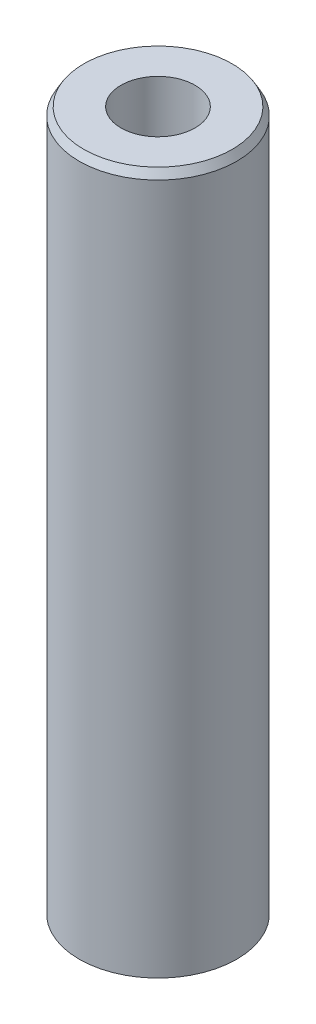
from build123d import *
from OCP.BRepFilletAPI import BRepFilletAPI_MakeChamfer

# Parameters (mm, degrees)
SKETCH1_R           = 27.5
BOSS_EXTRUDE1_DEPTH = 245.557551608
SKETCH2_R           = 12.927279261
CUT_EXTRUDE1_DEPTH  = 249.618203581
CHAMFER1_SIZE       = 2.784341038
CHAMFER1_SIZE2      = 1.607540048


with BuildPart() as part:
    # Sketch1 → Boss-Extrude1 (new body)
    with BuildSketch(Plane(origin=(0, 0, 0), x_dir=(1, 0, 0), z_dir=(0, 1, 0))):
        Circle(SKETCH1_R)
    extrude(amount=BOSS_EXTRUDE1_DEPTH)

    # Sketch2 → Cut-Extrude1 (cut, through all)
    with BuildSketch(Plane(origin=(0, 0, 0), x_dir=(1, 0, 0), z_dir=(0, 1, 0))):
        Circle(SKETCH2_R)
    extrude(amount=CUT_EXTRUDE1_DEPTH, mode=Mode.SUBTRACT)

    # Chamfer1: one chamfer whose edges measure the first distance from different faces: ONE call of the kernel's chamfer builder (chamfer() names one face for all edges)
    chamfer1_edges_1 = [part.edges().sort_by_distance(p)[0] for p in [
        (-27.5, 245.557551608, 0),
    ]]
    chamfer1_side_1 = [part.faces().sort_by_distance(p)[0] for p in [
        (-27.5, 122.778775804, 0),
    ]]
    chamfer1_edges_2 = [part.edges().sort_by_distance(p)[0] for p in [
        (-27.5, 0, 0),
    ]]
    chamfer1_side_2 = [part.faces().sort_by_distance(p)[0] for p in [
        (-26.722182541, 0, 0),
    ]]
    chamfer1 = BRepFilletAPI_MakeChamfer(part.part.solid().wrapped)
    for e in chamfer1_edges_1:
        chamfer1.Add(CHAMFER1_SIZE, CHAMFER1_SIZE2, e.wrapped, chamfer1_side_1[0].wrapped)  # the first distance lies on this face
    for e in chamfer1_edges_2:
        chamfer1.Add(CHAMFER1_SIZE, CHAMFER1_SIZE2, e.wrapped, chamfer1_side_2[0].wrapped)  # the first distance lies on this face
    add(Compound.cast(chamfer1.Shape()), mode=Mode.REPLACE)


solid = part.part
